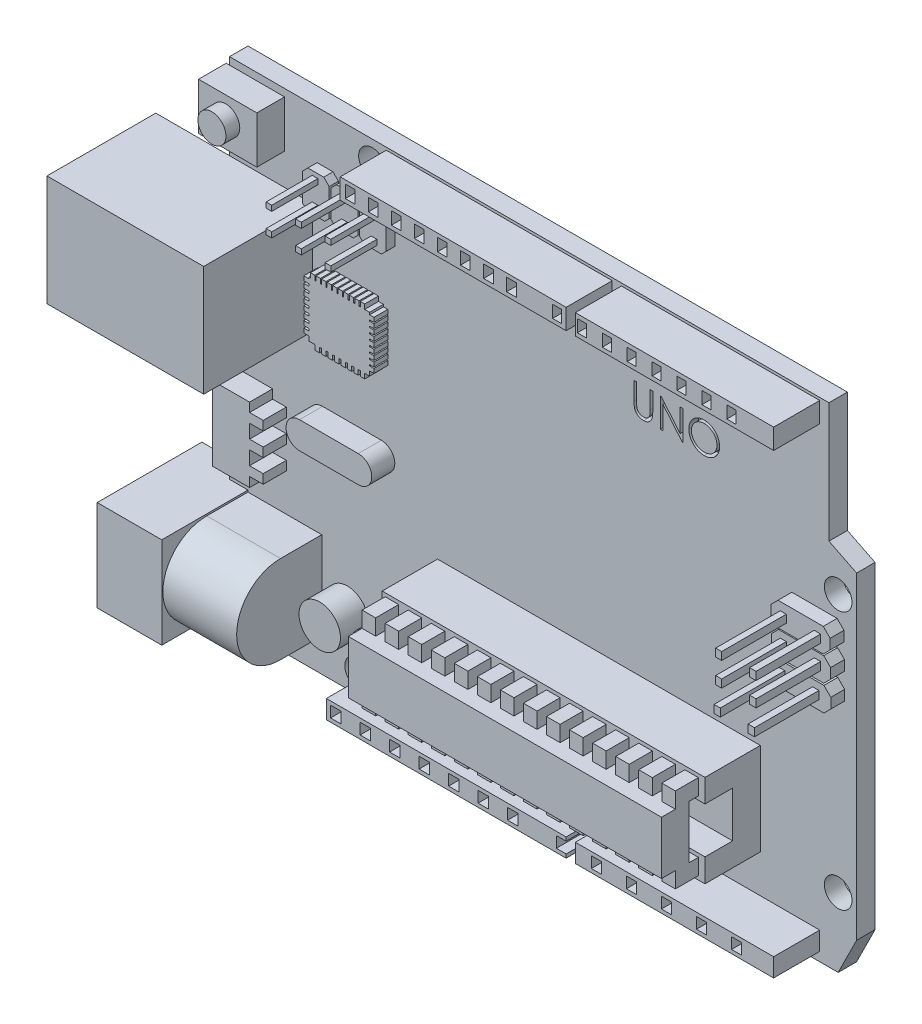
from build123d import *

# Parameters (mm, degrees)
BOSS_EXTRUDE1_DEPTH       = 2
SKETCH2_W                 = 26
SKETCH2_H                 = 2.2
SKETCH2_W_2               = 21.5
BOSS_EXTRUDE2_DEPTH       = 5
SKETCH3_W                 = 1.049746907
SKETCH3_H                 = 1.367804345
CUT_EXTRUDE1_DEPTH        = 5
SKETCH4_W                 = 0.97556606
SKETCH4_H                 = 1.335366902
CUT_EXTRUDE2_DEPTH        = 5
SKETCH5_W                 = 26
SKETCH5_H                 = 2
SKETCH5_W_2               = 21.5
BOSS_EXTRUDE3_DEPTH       = 5
SKETCH6_W                 = 1.138160402
SKETCH6_H                 = 1.2
CUT_EXTRUDE3_DEPTH        = 5
SKETCH7_W                 = 1.077432395
SKETCH7_H                 = 1.2
CUT_EXTRUDE4_DEPTH        = 5
SKETCH8_R                 = 1.5
CUT_EXTRUDE5_DEPTH        = 5
SKETCH9_W                 = 35
SKETCH9_H                 = 10
BOSS_EXTRUDE4_DEPTH       = 6
SKETCH10_W                = 2.996444985
SKETCH10_H                = 4.96379909
CUT_EXTRUDE7_DEPTH        = 35
SKETCH11_W                = 1.469225993
SKETCH11_H                = 1.721786389
CUT_EXTRUDE8_DEPTH        = 5
BOSS_EXTRUDE5_DEPTH       = 2.5
BOSS_EXTRUDE5_DEPTH_BACK  = 4
SKETCH12_W                = 1.469225993
SKETCH12_H                = 1.721786389
BOSS_EXTRUDE6_DEPTH       = 1.5
BOSS_EXTRUDE6_DEPTH_BACK  = 1.5
SKETCH14_W                = 33.969225993
SKETCH14_H                = 5.76399946
BOSS_EXTRUDE7_DEPTH       = 1.5
SKETCH16_W                = 0.697269988
SKETCH16_H                = 0.859966319
SKETCH16_W_2              = 0.674027655
SKETCH16_H_2              = 0.859966318
CUT_EXTRUDE9_DEPTH        = 0.7
BOSS_EXTRUDE8_DEPTH       = 7
BOSS_EXTRUDE8_DEPTH_BACK  = 0.7
SKETCH17_W                = 0.674027655
SKETCH17_H                = 0.859966319
SKETCH17_W_2              = 0.697269988
SKETCH17_W_3              = 0.649555692
SKETCH17_H_2              = 0.84214477
SKETCH17_H_3              = 0.870642791
BOSS_EXTRUDE9_DEPTH       = 1
SKETCH19_W                = 0.612883107
SKETCH19_H                = 0.582238952
BOSS_EXTRUDE10_DEPTH      = 5
BOSS_EXTRUDE11_DEPTH      = 2.5
SKETCH21_W                = 6.591002415
SKETCH21_H                = 5.991820376
BOSS_EXTRUDE12_DEPTH      = 1.5
SKETCH22_W                = 0.548805805
SKETCH22_H                = 0.464846659
SKETCH22_W_2              = 0.467458737
SKETCH22_H_2              = 0.53631011
SKETCH22_W_3              = 0.470164257
SKETCH22_H_3              = 0.517058878
BOSS_EXTRUDE13_DEPTH      = 1.5
SKETCH23_R                = 2.25
BOSS_EXTRUDE14_DEPTH      = 3
BOSS_EXTRUDE16_DEPTH      = 5
BOSS_EXTRUDE16_DEPTH_BACK = 2
SKETCH26_W                = 11.348912623
SKETCH26_H                = 9.9
BOSS_EXTRUDE18_DEPTH      = 8
BOSS_EXTRUDE18_DEPTH_BACK = 9
SKETCH29_W                = 11.8
SKETCH29_H                = 12
CUT_EXTRUDE11_DEPTH       = 11
SKETCH31_W                = 1.392223949
SKETCH31_H                = 4.495210074
BOSS_EXTRUDE19_DEPTH      = 10
SKETCH32_W                = 6.321988741
SKETCH32_H                = 5.098378018
BOSS_EXTRUDE20_DEPTH      = 3
SKETCH33_R                = 1.522317311
BOSS_EXTRUDE21_DEPTH      = 1.5
SKETCH34_W                = 4.013596682
SKETCH34_H                = 8.027193363
BOSS_EXTRUDE22_DEPTH      = 2.5
SKETCH35_W                = 1.481027251
SKETCH35_H                = 1.003309183
BOSS_EXTRUDE23_DEPTH      = 2.5
CUT_EXTRUDE12_DEPTH       = 1
SKETCH39_R                = 0.978088465
BOSS_EXTRUDE25_DEPTH      = 2
BOSS_EXTRUDE25_TAPER      = 26
SKETCH_2_W                = 1.5
SKETCH_2_H                = 2.2
CUT_EXTRUDE_1_DEPTH       = 5
EXTRUDE_2_DEPTH           = 8
SKETCH_6_R                = 3
CUT_EXTRUDE_3_DEPTH       = 5
SKETCH_7_R                = 0.459033844
EXTRUDE_3_DEPTH           = 5


with BuildPart() as part:
    # Sketch1 → Boss-Extrude1 (new body)
    with BuildSketch(Plane.XY):
        Polygon((-28.327231121, 33.812356979), (34.672768879, 33.812356979), (36.672768879, 33.812356979), (36.672768879, 20.812356979), (39.672768879, 19.318339885), (39.672768879, -15.171624714), (37.672768879, -19.187643021), (-28.327231121, -19.187643021), align=None)
    extrude(amount=BOSS_EXTRUDE1_DEPTH)

    # Sketch2 → Boss-Extrude2 (add)
    with BuildSketch(Plane.XY.offset(2)):
        with Locations((0.172768879, 32.424589372)):
            Rectangle(SKETCH2_W, SKETCH2_H)
        with Locations((24.922768879, 32.424589372)):
            Rectangle(SKETCH2_W_2, SKETCH2_H)
    extrude(amount=BOSS_EXTRUDE2_DEPTH)

    # Sketch3 → Cut-Extrude1 (cut)
    with BuildSketch(Plane.XY.offset(7)):
        with Locations((-15.253340387, 32.442227024)):
            Rectangle(SKETCH3_W, SKETCH3_H)
        with Locations((-12.753340387, 32.442227024)):
            Rectangle(SKETCH3_W, SKETCH3_H)
        with Locations((-10.253340387, 32.442227024)):
            Rectangle(SKETCH3_W, SKETCH3_H)
        with Locations((-7.753340388, 32.442227024)):
            Rectangle(SKETCH3_W, SKETCH3_H)
        with Locations((-5.253340387, 32.442227024)):
            Rectangle(SKETCH3_W, SKETCH3_H)
        with Locations((-2.753340388, 32.442227024)):
            Rectangle(SKETCH3_W, SKETCH3_H)
        with Locations((-0.253340387, 32.442227024)):
            Rectangle(SKETCH3_W, SKETCH3_H)
        with Locations((2.246659613, 32.442227024)):
            Rectangle(SKETCH3_W, SKETCH3_H)
        with Locations((4.746659613, 32.442227024)):
            Rectangle(SKETCH3_W, SKETCH3_H)
        with Locations((7.246659613, 32.442227024)):
            Rectangle(SKETCH3_W, SKETCH3_H)
    extrude(amount=-CUT_EXTRUDE1_DEPTH, mode=Mode.SUBTRACT)

    # Sketch4 → Cut-Extrude2 (cut)
    with BuildSketch(Plane.XY.offset(7)):
        with Locations((12.184465787, 32.409753718)):
            Rectangle(SKETCH4_W, SKETCH4_H)
        with Locations((14.884465787, 32.409753718)):
            Rectangle(SKETCH4_W, SKETCH4_H)
        with Locations((17.584465787, 32.409753718)):
            Rectangle(SKETCH4_W, SKETCH4_H)
        with Locations((20.284465787, 32.409753718)):
            Rectangle(SKETCH4_W, SKETCH4_H)
        with Locations((22.984465787, 32.409753718)):
            Rectangle(SKETCH4_W, SKETCH4_H)
        with Locations((25.684465787, 32.409753718)):
            Rectangle(SKETCH4_W, SKETCH4_H)
        with Locations((28.384465787, 32.409753718)):
            Rectangle(SKETCH4_W, SKETCH4_H)
        with Locations((31.084465787, 32.409753718)):
            Rectangle(SKETCH4_W, SKETCH4_H)
    extrude(amount=-CUT_EXTRUDE2_DEPTH, mode=Mode.SUBTRACT)

    # Sketch5 → Boss-Extrude3 (add)
    with BuildSketch(Plane.XY.offset(2)):
        with Locations((0.172768879, -17.212225696)):
            Rectangle(SKETCH5_W, SKETCH5_H)
        with Locations((24.922768879, -17.212225696)):
            Rectangle(SKETCH5_W_2, SKETCH5_H)
    extrude(amount=BOSS_EXTRUDE3_DEPTH)

    # Sketch6 → Cut-Extrude3 (cut)
    with BuildSketch(Plane.XY.offset(7)):
        with Locations((-15.002920658, -17.212225696)):
            Rectangle(SKETCH6_W, SKETCH6_H)
        with Locations((-11.802920658, -17.212225696)):
            Rectangle(SKETCH6_W, SKETCH6_H)
        with Locations((-8.602920658, -17.212225696)):
            Rectangle(SKETCH6_W, SKETCH6_H)
        with Locations((-5.402920658, -17.212225696)):
            Rectangle(SKETCH6_W, SKETCH6_H)
        with Locations((-2.202920658, -17.212225696)):
            Rectangle(SKETCH6_W, SKETCH6_H)
        with Locations((0.997079342, -17.212225696)):
            Rectangle(SKETCH6_W, SKETCH6_H)
        with Locations((4.197079342, -17.212225696)):
            Rectangle(SKETCH6_W, SKETCH6_H)
        with Locations((7.397079342, -17.212225696)):
            Rectangle(SKETCH6_W, SKETCH6_H)
    extrude(amount=-CUT_EXTRUDE3_DEPTH, mode=Mode.SUBTRACT)

    # Sketch7 → Cut-Extrude4 (cut)
    with BuildSketch(Plane.XY.offset(7)):
        with Locations((12.648591204, -17.212225696)):
            Rectangle(SKETCH7_W, SKETCH7_H)
        with Locations((16.448591204, -17.212225696)):
            Rectangle(SKETCH7_W, SKETCH7_H)
        with Locations((20.248591203, -17.212225696)):
            Rectangle(SKETCH7_W, SKETCH7_H)
        with Locations((24.048591204, -17.212225696)):
            Rectangle(SKETCH7_W, SKETCH7_H)
        with Locations((27.848591203, -17.212225696)):
            Rectangle(SKETCH7_W, SKETCH7_H)
        with Locations((31.648591204, -17.212225696)):
            Rectangle(SKETCH7_W, SKETCH7_H)
    extrude(amount=-CUT_EXTRUDE4_DEPTH, mode=Mode.SUBTRACT)

    # Sketch8 → Cut-Extrude5 (cut)
    with BuildSketch(Plane.XY.offset(2)):
        with Locations((37.672768879, 16.312356979)):
            Circle(SKETCH8_R)
        with Locations((37.672768879, -11.687643021)):
            Circle(SKETCH8_R)
        with Locations((-14.327231121, -17.128595339)):
            Circle(SKETCH8_R)
        with Locations((-12.827231121, 31.512356979)):
            Circle(SKETCH8_R)
    extrude(amount=-CUT_EXTRUDE5_DEPTH, mode=Mode.SUBTRACT)

    # Sketch9 → Boss-Extrude4 (add)
    with BuildSketch(Plane.XY.offset(2)):
        with Locations((11.729432951, -7.092296208)):
            Rectangle(SKETCH9_W, SKETCH9_H)
    extrude(amount=BOSS_EXTRUDE4_DEPTH)

    # Sketch10 → Cut-Extrude7 (cut)
    with BuildSketch(Plane(origin=(29.229432951, 0, 0), x_dir=(0, 0, -1), z_dir=(1, 0, 0))):
        with Locations((-6.501777507, -7.074195753)):
            Rectangle(SKETCH10_W, SKETCH10_H)
    extrude(amount=-CUT_EXTRUDE7_DEPTH, mode=Mode.SUBTRACT)

    # Sketch11 → Cut-Extrude8 (cut)
    with BuildSketch(Plane.XY.offset(8)):
        with Locations((-4.718608535, -3.331403014)):
            Rectangle(SKETCH11_W, SKETCH11_H)
        with Locations((-4.718608535, -10.817188863)):
            Rectangle(SKETCH11_W, SKETCH11_H)
        with Locations((-2.218608534, -3.331403014)):
            Rectangle(SKETCH11_W, SKETCH11_H)
        with Locations((-2.218608534, -10.817188863)):
            Rectangle(SKETCH11_W, SKETCH11_H)
        with Locations((0.281391466, -3.331403014)):
            Rectangle(SKETCH11_W, SKETCH11_H)
        with Locations((0.281391466, -10.817188863)):
            Rectangle(SKETCH11_W, SKETCH11_H)
        with Locations((2.781391466, -3.331403014)):
            Rectangle(SKETCH11_W, SKETCH11_H)
        with Locations((2.781391466, -10.817188863)):
            Rectangle(SKETCH11_W, SKETCH11_H)
        with Locations((5.281391466, -3.331403014)):
            Rectangle(SKETCH11_W, SKETCH11_H)
        with Locations((5.281391466, -10.817188863)):
            Rectangle(SKETCH11_W, SKETCH11_H)
        with Locations((7.781391466, -3.331403014)):
            Rectangle(SKETCH11_W, SKETCH11_H)
        with Locations((7.781391466, -10.817188863)):
            Rectangle(SKETCH11_W, SKETCH11_H)
        with Locations((10.281391466, -3.331403014)):
            Rectangle(SKETCH11_W, SKETCH11_H)
        with Locations((10.281391466, -10.817188863)):
            Rectangle(SKETCH11_W, SKETCH11_H)
        with Locations((12.781391466, -3.331403014)):
            Rectangle(SKETCH11_W, SKETCH11_H)
        with Locations((12.781391466, -10.817188863)):
            Rectangle(SKETCH11_W, SKETCH11_H)
        with Locations((15.281391466, -3.331403014)):
            Rectangle(SKETCH11_W, SKETCH11_H)
        with Locations((15.281391466, -10.817188863)):
            Rectangle(SKETCH11_W, SKETCH11_H)
        with Locations((17.781391466, -3.331403014)):
            Rectangle(SKETCH11_W, SKETCH11_H)
        with Locations((17.781391466, -10.817188863)):
            Rectangle(SKETCH11_W, SKETCH11_H)
        with Locations((20.281391466, -3.331403014)):
            Rectangle(SKETCH11_W, SKETCH11_H)
        with Locations((20.281391466, -10.817188863)):
            Rectangle(SKETCH11_W, SKETCH11_H)
        with Locations((22.781391466, -3.331403014)):
            Rectangle(SKETCH11_W, SKETCH11_H)
        with Locations((22.781391466, -10.817188863)):
            Rectangle(SKETCH11_W, SKETCH11_H)
        with Locations((25.281391466, -3.331403014)):
            Rectangle(SKETCH11_W, SKETCH11_H)
        with Locations((25.281391466, -10.817188863)):
            Rectangle(SKETCH11_W, SKETCH11_H)
        with Locations((27.781391466, -3.331403014)):
            Rectangle(SKETCH11_W, SKETCH11_H)
        with Locations((27.781391466, -10.817188863)):
            Rectangle(SKETCH11_W, SKETCH11_H)
    extrude(amount=-CUT_EXTRUDE8_DEPTH, mode=Mode.SUBTRACT)

    # Sketch12 → Boss-Extrude5 (add, two sides: drawn at the far end of the back side and taken through both)
    with BuildSketch(Plane.XY.offset(8).offset(-BOSS_EXTRUDE5_DEPTH_BACK)):
        with Locations((-4.718608535, -3.331403014)):
            Rectangle(SKETCH12_W, SKETCH12_H)
        with Locations((-4.718608535, -10.817188863)):
            Rectangle(SKETCH12_W, SKETCH12_H)
        with Locations((-2.218608534, -3.331403014)):
            Rectangle(SKETCH12_W, SKETCH12_H)
        with Locations((-2.218608534, -10.817188863)):
            Rectangle(SKETCH12_W, SKETCH12_H)
        with Locations((0.281391466, -3.331403014)):
            Rectangle(SKETCH12_W, SKETCH12_H)
        with Locations((0.281391466, -10.817188863)):
            Rectangle(SKETCH12_W, SKETCH12_H)
        with Locations((2.781391466, -3.331403014)):
            Rectangle(SKETCH12_W, SKETCH12_H)
        with Locations((2.781391466, -10.817188863)):
            Rectangle(SKETCH12_W, SKETCH12_H)
        with Locations((5.281391466, -3.331403014)):
            Rectangle(SKETCH12_W, SKETCH12_H)
        with Locations((5.281391466, -10.817188863)):
            Rectangle(SKETCH12_W, SKETCH12_H)
        with Locations((7.781391466, -3.331403014)):
            Rectangle(SKETCH12_W, SKETCH12_H)
        with Locations((7.781391466, -10.817188863)):
            Rectangle(SKETCH12_W, SKETCH12_H)
        with Locations((10.281391466, -3.331403014)):
            Rectangle(SKETCH12_W, SKETCH12_H)
        with Locations((10.281391466, -10.817188863)):
            Rectangle(SKETCH12_W, SKETCH12_H)
        with Locations((12.781391466, -3.331403014)):
            Rectangle(SKETCH12_W, SKETCH12_H)
        with Locations((12.781391466, -10.817188863)):
            Rectangle(SKETCH12_W, SKETCH12_H)
        with Locations((15.281391466, -3.331403014)):
            Rectangle(SKETCH12_W, SKETCH12_H)
        with Locations((15.281391466, -10.817188863)):
            Rectangle(SKETCH12_W, SKETCH12_H)
        with Locations((17.781391466, -3.331403014)):
            Rectangle(SKETCH12_W, SKETCH12_H)
        with Locations((17.781391466, -10.817188863)):
            Rectangle(SKETCH12_W, SKETCH12_H)
        with Locations((20.281391466, -3.331403014)):
            Rectangle(SKETCH12_W, SKETCH12_H)
        with Locations((20.281391466, -10.817188863)):
            Rectangle(SKETCH12_W, SKETCH12_H)
        with Locations((22.781391466, -3.331403014)):
            Rectangle(SKETCH12_W, SKETCH12_H)
        with Locations((22.781391466, -10.817188863)):
            Rectangle(SKETCH12_W, SKETCH12_H)
        with Locations((25.281391466, -3.331403014)):
            Rectangle(SKETCH12_W, SKETCH12_H)
        with Locations((25.281391466, -10.817188863)):
            Rectangle(SKETCH12_W, SKETCH12_H)
        with Locations((27.781391466, -3.331403014)):
            Rectangle(SKETCH12_W, SKETCH12_H)
        with Locations((27.781391466, -10.817188863)):
            Rectangle(SKETCH12_W, SKETCH12_H)
    extrude(amount=BOSS_EXTRUDE5_DEPTH + BOSS_EXTRUDE5_DEPTH_BACK)

    # Sketch14 → Boss-Extrude6 (add, two sides: drawn at the far end of the back side and taken through both)
    with BuildSketch(Plane.XY.offset(10.5).offset(-BOSS_EXTRUDE6_DEPTH_BACK)):
        with Locations((11.531391466, -7.074295938)):
            Rectangle(SKETCH14_W, SKETCH14_H)
    extrude(amount=BOSS_EXTRUDE6_DEPTH + BOSS_EXTRUDE6_DEPTH_BACK)

    # Sketch15 → Boss-Extrude7 (add)
    with BuildSketch(Plane.XY.offset(2)):
        Polygon((32.648796449, 14.001905849), (37.554364321, 14.001905849), (38.30086378, 13.25540639), (38.30086378, 12.153430998), (37.554364321, 11.40693154), (32.648796449, 11.40693154), (31.902296991, 12.153430998), (31.902296991, 13.25540639), align=None)
        Polygon((31.95745647, 9.432230003), (31.95745647, 10.534205394), (32.703955929, 11.280704853), (37.609523801, 11.280704853), (38.356023259, 10.534205394), (38.356023259, 9.432230003), (37.609523801, 8.685730544), (32.703955929, 8.685730544), align=None)
        Polygon((37.627997507, 8.494934517), (38.374496966, 7.748435058), (38.374496966, 6.646459667), (37.627997507, 5.899960208), (32.722429635, 5.899960208), (31.975930177, 6.646459667), (31.975930177, 7.748435058), (32.722429635, 8.494934517), align=None)
    extrude(amount=BOSS_EXTRUDE7_DEPTH)

    # Sketch16 → Cut-Extrude9 (cut)
    with BuildSketch(Plane.XY.offset(3.5)):
        with Locations((36.906767375, 10.134489985)):
            Rectangle(SKETCH16_W, SKETCH16_H)
        with Locations((33.219368171, 12.701903015)):
            Rectangle(SKETCH16_W_2, SKETCH16_H_2)
        with Locations((36.914899108, 12.701903015)):
            Rectangle(SKETCH16_W, SKETCH16_H_2)
        with Locations((33.211236438, 10.134489985)):
            Rectangle(SKETCH16_W_2, SKETCH16_H)
        with Locations((36.746215115, 7.322494267)):
            Rectangle(SKETCH16_W, SKETCH16_H)
        with Locations((33.050684178, 7.322494267)):
            Rectangle(SKETCH16_W_2, SKETCH16_H)
    extrude(amount=-CUT_EXTRUDE9_DEPTH, mode=Mode.SUBTRACT)

    # Sketch17 → Boss-Extrude8 (add, two sides: drawn at the far end of the back side and taken through both)
    with BuildSketch(Plane.XY.offset(3.5).offset(-BOSS_EXTRUDE8_DEPTH_BACK)):
        with Locations((33.050684178, 7.322494267)):
            Rectangle(SKETCH17_W, SKETCH17_H)
        with Locations((36.746215115, 7.322494267)):
            Rectangle(SKETCH17_W_2, SKETCH17_H)
        with Locations((36.91930074, 10.120952765)):
            Rectangle(SKETCH17_W_2, SKETCH17_H)
        with Locations((33.211533821, 10.120952765)):
            Rectangle(SKETCH17_W_3, SKETCH17_H)
        with Locations((33.211533821, 12.706904035)):
            Rectangle(SKETCH17_W_3, SKETCH17_H_2)
        with Locations((36.91930074, 12.700598239)):
            Rectangle(SKETCH17_W_2, SKETCH17_H_3)
    extrude(amount=BOSS_EXTRUDE8_DEPTH + BOSS_EXTRUDE8_DEPTH_BACK)

    # Sketch18 → Boss-Extrude9 (add)
    with BuildSketch(Plane.XY.offset(2)):
        Polygon((-18.835236403, 28.604565204), (-17.111655926, 28.604565204), (-16.517073728, 28.016389961), (-16.517073728, 25.003042012), (-17.00436299, 24.510444738), (-18.893844337, 24.510444738), (-19.417073728, 25.028036039), (-19.417073728, 28.016389961), align=None)
        Polygon((-15.725202743, 28.590242596), (-14.001622266, 28.590242596), (-13.407040068, 28.002067354), (-13.407040068, 24.988719404), (-13.89432933, 24.496122131), (-15.783810676, 24.496122131), (-16.307040068, 25.013713432), (-16.307040068, 28.002067354), align=None)
        Polygon((-12.675606392, 28.604565204), (-10.952025915, 28.604565204), (-10.357443717, 28.016389961), (-10.357443717, 25.003042012), (-10.844732979, 24.510444738), (-12.734214326, 24.510444738), (-13.257443717, 25.028036039), (-13.257443717, 28.016389961), align=None)
    extrude(amount=BOSS_EXTRUDE9_DEPTH)

    # Sketch19 → Boss-Extrude10 (add)
    with BuildSketch(Plane.XY.offset(3)):
        with Locations((-18.055934941, 25.361258481)):
            Rectangle(SKETCH19_W, SKETCH19_H)
        with Locations((-18.055934941, 27.858757142)):
            Rectangle(SKETCH19_W, SKETCH19_H)
        with Locations((-14.85593494, 27.858757142)):
            Rectangle(SKETCH19_W, SKETCH19_H)
        with Locations((-14.85593494, 25.361258481)):
            Rectangle(SKETCH19_W, SKETCH19_H)
        with Locations((-11.65593494, 27.858757142)):
            Rectangle(SKETCH19_W, SKETCH19_H)
        with Locations((-11.65593494, 25.361258481)):
            Rectangle(SKETCH19_W, SKETCH19_H)
    extrude(amount=BOSS_EXTRUDE10_DEPTH)

    # Sketch20 → Boss-Extrude11 (add)
    with BuildSketch(Plane.XY.offset(2)):
        with BuildLine():
            Line((-18.242145427, 6.015306116), (-11.866132062, 6.015306116))
            ThreePointArc((-11.866132062, 6.015306116), (-10.404962333, 4.554136386), (-11.866132062, 3.092966657))
            Line((-11.866132062, 3.092966657), (-18.242145427, 3.092966657))
            ThreePointArc((-18.242145427, 3.092966657), (-19.703315156, 4.554136386), (-18.242145427, 6.015306116))
        make_face()
    extrude(amount=BOSS_EXTRUDE11_DEPTH)

    # Sketch21 → Boss-Extrude12 (add)
    with BuildSketch(Plane.XY.offset(2)):
        with Locations((-14.934167726, 15.901314488)):
            Rectangle(SKETCH21_W, SKETCH21_H)
    extrude(amount=BOSS_EXTRUDE12_DEPTH)

    # Sketch22 → Boss-Extrude13 (add)
    with BuildSketch(Plane.XY.offset(3.5)):
        with Locations((-18.504071835, 18.526676124)):
            Rectangle(SKETCH22_W, SKETCH22_H)
        with Locations((-18.504071835, 17.826676124)):
            Rectangle(SKETCH22_W, SKETCH22_H)
        with Locations((-18.504071835, 17.126676124)):
            Rectangle(SKETCH22_W, SKETCH22_H)
        with Locations((-18.504071835, 16.426676124)):
            Rectangle(SKETCH22_W, SKETCH22_H)
        with Locations((-18.504071835, 15.726676124)):
            Rectangle(SKETCH22_W, SKETCH22_H)
        with Locations((-18.504071835, 15.026676123)):
            Rectangle(SKETCH22_W, SKETCH22_H)
        with Locations((-18.504071835, 14.326676124)):
            Rectangle(SKETCH22_W, SKETCH22_H)
        with Locations((-18.504071835, 13.626676124)):
            Rectangle(SKETCH22_W, SKETCH22_H)
        with Locations((-17.308395783, 12.637249245)):
            Rectangle(SKETCH22_W_2, SKETCH22_H_2)
        with Locations((-16.608395784, 12.637249245)):
            Rectangle(SKETCH22_W_2, SKETCH22_H_2)
        with Locations((-15.908395784, 12.637249245)):
            Rectangle(SKETCH22_W_2, SKETCH22_H_2)
        with Locations((-15.208395784, 12.637249245)):
            Rectangle(SKETCH22_W_2, SKETCH22_H_2)
        with Locations((-14.508395784, 12.637249245)):
            Rectangle(SKETCH22_W_2, SKETCH22_H_2)
        with Locations((-13.808395783, 12.637249245)):
            Rectangle(SKETCH22_W_2, SKETCH22_H_2)
        with Locations((-13.108395784, 12.637249245)):
            Rectangle(SKETCH22_W_2, SKETCH22_H_2)
        with Locations((-11.40358439, 13.626676124)):
            Rectangle(SKETCH22_W_3, SKETCH22_H)
        with Locations((-11.40358439, 14.226676124)):
            Rectangle(SKETCH22_W_3, SKETCH22_H)
        with Locations((-11.40358439, 14.826676124)):
            Rectangle(SKETCH22_W_3, SKETCH22_H)
        with Locations((-11.40358439, 15.426676124)):
            Rectangle(SKETCH22_W_3, SKETCH22_H)
        with Locations((-11.40358439, 16.026676123)):
            Rectangle(SKETCH22_W_3, SKETCH22_H)
        with Locations((-11.40358439, 16.626676124)):
            Rectangle(SKETCH22_W_3, SKETCH22_H)
        with Locations((-11.40358439, 17.826676124)):
            Rectangle(SKETCH22_W_3, SKETCH22_H)
        with Locations((-11.40358439, 18.426676124)):
            Rectangle(SKETCH22_W_3, SKETCH22_H)
        with Locations((-13.008395784, 19.155754115)):
            Rectangle(SKETCH22_W_2, SKETCH22_H_3)
        with Locations((-13.608395784, 19.155754115)):
            Rectangle(SKETCH22_W_2, SKETCH22_H_3)
        with Locations((-14.808395783, 19.155754115)):
            Rectangle(SKETCH22_W_2, SKETCH22_H_3)
        with Locations((-15.408395784, 19.155754115)):
            Rectangle(SKETCH22_W_2, SKETCH22_H_3)
        with Locations((-16.008395783, 19.155754115)):
            Rectangle(SKETCH22_W_2, SKETCH22_H_3)
        with Locations((-16.608395784, 19.155754115)):
            Rectangle(SKETCH22_W_2, SKETCH22_H_3)
        with Locations((-17.208395784, 19.155754115)):
            Rectangle(SKETCH22_W_2, SKETCH22_H_3)
        with Locations((-17.808395783, 19.155754115)):
            Rectangle(SKETCH22_W_2, SKETCH22_H_3)
        with Locations((-12.408395784, 12.637249245)):
            Rectangle(SKETCH22_W_2, SKETCH22_H_2)
        with Locations((-11.40358439, 17.226676123)):
            Rectangle(SKETCH22_W_3, SKETCH22_H)
        with Locations((-12.408395784, 19.155754115)):
            Rectangle(SKETCH22_W_2, SKETCH22_H_3)
        with Locations((-14.208395784, 19.155754115)):
            Rectangle(SKETCH22_W_2, SKETCH22_H_3)
    extrude(amount=-BOSS_EXTRUDE13_DEPTH)

    # Sketch23 → Boss-Extrude14 (add)
    with BuildSketch(Plane.XY.offset(2)):
        with Locations((-15.547522044, -11.757884034)):
            Circle(SKETCH23_R)
        with Locations((-9.964370412, -11.757884034)):
            Circle(SKETCH23_R)
    extrude(amount=BOSS_EXTRUDE14_DEPTH)

    # Sketch26 → Boss-Extrude16 (add, two sides: drawn at the far end of the back side and taken through both)
    with BuildSketch(Plane.ZY.offset(28.327231121).offset(-BOSS_EXTRUDE16_DEPTH_BACK)):
        with Locations((5.674456312, -10.837643021)):
            Rectangle(SKETCH26_W, SKETCH26_H)
    extrude(amount=BOSS_EXTRUDE16_DEPTH + BOSS_EXTRUDE16_DEPTH_BACK)

    # Sketch29 → Boss-Extrude18 (add, two sides: drawn at the far end of the back side and taken through both)
    with BuildSketch(Plane.ZY.offset(28.327231121).offset(-BOSS_EXTRUDE18_DEPTH_BACK)):
        with Locations((7.9, 18.510444738)):
            Rectangle(SKETCH29_W, SKETCH29_H)
    extrude(amount=BOSS_EXTRUDE18_DEPTH + BOSS_EXTRUDE18_DEPTH_BACK)

    # Sketch30 → Cut-Extrude11 (cut)
    with BuildSketch(Plane.ZY.offset(36.327231121)):
        Polygon((4.438160214, 22.883398461), (9.895776615, 22.883398461), (11.679433869, 20.723720353), (11.679433869, 16.297169123), (9.895776615, 14.137491015), (4.438160214, 14.137491015), align=None)
    extrude(amount=-CUT_EXTRUDE11_DEPTH, mode=Mode.SUBTRACT)

    # Sketch31 → Boss-Extrude19 (add)
    with BuildSketch(Plane.ZY.offset(25.327231121)):
        with Locations((7.94452788, 18.510444738)):
            Rectangle(SKETCH31_W, SKETCH31_H)
    extrude(amount=BOSS_EXTRUDE19_DEPTH)

    # Sketch32 → Boss-Extrude20 (add)
    with BuildSketch(Plane.XY.offset(2)):
        with Locations((-25.525277343, 30.465872101)):
            Rectangle(SKETCH32_W, SKETCH32_H)
    extrude(amount=BOSS_EXTRUDE20_DEPTH)

    # Sketch33 → Boss-Extrude21 (add)
    with BuildSketch(Plane.XY.offset(5)):
        with Locations((-25.739155252, 30.658984244)):
            Circle(SKETCH33_R)
    extrude(amount=BOSS_EXTRUDE21_DEPTH)

    # Sketch34 → Boss-Extrude22 (add)
    with BuildSketch(Plane.XY.offset(2)):
        with Locations((-25.6619707, 0.94293189)):
            Rectangle(SKETCH34_W, SKETCH34_H)
    extrude(amount=BOSS_EXTRUDE22_DEPTH)

    # Sketch35 → Boss-Extrude23 (add)
    with BuildSketch(Plane.XY.offset(4.5)):
        with Locations((-22.914658734, 3.478764566)):
            Rectangle(SKETCH35_W, SKETCH35_H)
        with Locations((-22.914658734, 0.978764566)):
            Rectangle(SKETCH35_W, SKETCH35_H)
        with Locations((-22.914658734, -1.521235435)):
            Rectangle(SKETCH35_W, SKETCH35_H)
    extrude(amount=-BOSS_EXTRUDE23_DEPTH)

    # Sketch36 → Cut-Extrude12 (cut)
    # profile 1 of 3: a face of its own
    with BuildSketch(Plane.XY.offset(2)):
        with BuildLine():
            Line((15.53488896, 25.344380581), (15.819824857, 25.344380581))
            Line((15.819824857, 25.344380581), (15.819824857, 23.442051855))
            add(Edge.make_bspline(
                [(15.819824857, 23.442051855), (15.819782454, 23.415127187), (15.819701986, 23.364032991), (15.82023948, 23.29130889), (15.821744765, 23.226654588), (15.822693781, 23.169820865), (15.824805005, 23.121068516), (15.826526805, 23.080133413), (15.828740738, 23.047209386), (15.831401495, 23.02799526), (15.83254521, 23.01973615)],
                knots=[0, 0, 0, 0, 1.528628734, 2.90083645, 4.128790002, 5.200304208, 6.127813768, 6.898992206, 7.526736466, 8, 8, 8, 8], degree=3))
            add(Edge.make_bspline(
                [(15.83254521, 23.01973615), (15.837241904, 22.989939443), (15.846370652, 22.932024967), (15.86963558, 22.849558169), (15.902127171, 22.775234632), (15.940629074, 22.706735103), (15.991367943, 22.645966184), (16.052149721, 22.589984899), (16.125789554, 22.541024762), (16.207668818, 22.496256525), (16.295920426, 22.460274629), (16.386100646, 22.433066363), (16.47685392, 22.41648479), (16.53761087, 22.414564786), (16.567781588, 22.41361135)],
                knots=[0, 0, 0, 0, 1.035780045, 2.013197591, 2.933192213, 3.817615948, 4.702609284, 5.640816605, 6.646850145, 7.73207398, 8.84249596, 9.914020372, 10.964143139, 12, 12, 12, 12], degree=3))
            add(Edge.make_bspline(
                [(16.567781588, 22.41361135), (16.593683909, 22.414585486), (16.645338948, 22.416528131), (16.722089067, 22.428558143), (16.796837737, 22.45023937), (16.869954068, 22.478215437), (16.938489604, 22.515179323), (17.002482583, 22.557879299), (17.059599867, 22.607963451), (17.111722479, 22.663390192), (17.157111314, 22.725928439), (17.196455135, 22.794216464), (17.228682228, 22.869281943), (17.244596712, 22.922036312), (17.252772573, 22.949138193)],
                knots=[0, 0, 0, 0, 0.994687771, 1.983630487, 2.973142513, 3.978332533, 4.983357753, 5.956394766, 6.925816176, 7.893390482, 8.871859704, 9.88551698, 10.913711441, 12, 12, 12, 12], degree=3))
            add(Edge.make_bspline(
                [(17.252772573, 22.949138193), (17.255494116, 22.960340114), (17.261558809, 22.985302508), (17.267225771, 23.027503965), (17.273128119, 23.077296459), (17.277223479, 23.135037747), (17.281216014, 23.200534343), (17.283604588, 23.274127448), (17.28470861, 23.355549834), (17.285037613, 23.412370688), (17.285209472, 23.442051855)],
                knots=[0, 0, 0, 0, 0.558680831, 1.244966039, 2.062412453, 2.990489873, 4.051219941, 5.244515665, 6.560634259, 8, 8, 8, 8], degree=3))
            Line((17.285209472, 23.442051855), (17.285209472, 25.344380581))
            Line((17.285209472, 25.344380581), (17.57014537, 25.344380581))
            Line((17.57014537, 25.344380581), (17.57014537, 23.426787432))
            add(Edge.make_bspline(
                [(17.57014537, 23.426787432), (17.569914846, 23.39222676), (17.569464966, 23.324779506), (17.565563729, 23.225945059), (17.55934345, 23.13218914), (17.55055497, 23.043499147), (17.538909975, 22.960192445), (17.52596031, 22.881538834), (17.509468877, 22.808102905), (17.490207148, 22.739312069), (17.468187573, 22.673829496), (17.43966596, 22.611682396), (17.407530878, 22.550981476), (17.369417585, 22.492644835), (17.326590117, 22.436414176), (17.278101806, 22.382630515), (17.225556318, 22.33043438), (17.168080146, 22.28116467), (17.106620741, 22.235981084), (17.041360922, 22.196250249), (16.972801995, 22.162664539), (16.901122173, 22.135018522), (16.826290868, 22.114231707), (16.748306192, 22.098742101), (16.666990638, 22.089940732), (16.611686985, 22.088632695), (16.583682029, 22.087970324)],
                knots=[0, 0, 0, 0, 1.316592851, 2.569410997, 3.76748051, 4.895814652, 5.963796859, 6.97159953, 7.931736103, 8.829262218, 9.692595152, 10.560224239, 11.431080259, 12.30701507, 13.211635791, 14.121146779, 15.063487852, 16.031507147, 17.00238618, 17.966455255, 18.938106653, 19.907068911, 20.888905087, 21.893141452, 22.933117798, 24, 24, 24, 24], degree=3))
            add(Edge.make_bspline(
                [(16.583682029, 22.087970324), (16.553139343, 22.088682219), (16.493214702, 22.090078953), (16.40491517, 22.098082447), (16.320265863, 22.113157705), (16.238372746, 22.132352797), (16.160350752, 22.158826616), (16.085154556, 22.189758486), (16.014072038, 22.227747144), (15.945950029, 22.270014007), (15.882609, 22.317570643), (15.824463499, 22.369404944), (15.77141753, 22.424686572), (15.724365213, 22.484014047), (15.682526982, 22.546925952), (15.646486003, 22.613600263), (15.615540417, 22.684011164), (15.599568745, 22.732954424), (15.591494529, 22.757696887)],
                knots=[0, 0, 0, 0, 1.13879206, 2.234305948, 3.301075583, 4.341971843, 5.366689343, 6.369221514, 7.369726634, 8.367512178, 9.355451585, 10.318319045, 11.268648973, 12.207971039, 13.137398894, 14.081662264, 15.030215811, 16, 16, 16, 16], degree=3))
            add(Edge.make_bspline(
                [(15.591494529, 22.757696887), (15.586798106, 22.774599294), (15.576611462, 22.811260991), (15.5657028, 22.871936591), (15.556532418, 22.941800123), (15.547909519, 23.02085637), (15.542821393, 23.109166606), (15.538360574, 23.206692551), (15.534857534, 23.313552131), (15.534878192, 23.387987299), (15.53488896, 23.426787432)],
                knots=[0, 0, 0, 0, 0.625038921, 1.35572334, 2.194682327, 3.136881307, 4.189498639, 5.346923369, 6.617055217, 8, 8, 8, 8], degree=3))
            Line((15.53488896, 23.426787432), (15.53488896, 25.344380581))
        make_face()
    # profile 2 of 3: a face of its own
    with BuildSketch(Plane.XY.offset(2)):
        Polygon((18.384247934, 22.169380581), (18.384247934, 25.344380581), (18.444033591, 25.344380581), (20.541619729, 22.84546732), (20.541619729, 25.344380581), (20.826555626, 25.344380581), (20.826555626, 22.169380581), (20.761681828, 22.169380581), (18.669183831, 24.662569683), (18.669183831, 22.169380581), align=None)
    # profile 3 of 3: a face of its own
    with BuildSketch(Plane.XY.offset(2)):
        with BuildLine():
            add(Edge.make_bspline(
                [(23.12639537, 25.425790837), (23.18518558, 25.424301781), (23.300654404, 25.421377152), (23.470358061, 25.398989679), (23.632369326, 25.360258861), (23.788007952, 25.308676013), (23.935412295, 25.239865249), (24.075691862, 25.156693721), (24.208512883, 25.058290077), (24.332085136, 24.945414992), (24.445166798, 24.822602859), (24.544794567, 24.691540755), (24.628290076, 24.553021127), (24.696857183, 24.407460231), (24.750649493, 24.25518726), (24.787768911, 24.095390414), (24.811479947, 23.92910506), (24.814251974, 23.815687833), (24.81565819, 23.758152616)],
                knots=[0, 0, 0, 0, 1.065120563, 2.091984664, 3.0946048, 4.079830382, 5.057816894, 6.036188127, 7.030412546, 8.04752943, 9.064399622, 10.05169764, 11.02544977, 11.989514704, 12.962713494, 13.945757189, 14.957906945, 16, 16, 16, 16], degree=3))
            add(Edge.make_bspline(
                [(24.81565819, 23.758152616), (24.81425218, 23.701041218), (24.811480771, 23.588468037), (24.787741952, 23.423237913), (24.750511902, 23.264405638), (24.697356717, 23.112236367), (24.629116462, 22.966569577), (24.545064985, 22.827788555), (24.446058315, 22.695847803), (24.333384958, 22.572192742), (24.21055687, 22.458802179), (24.07881227, 22.359997199), (23.941114044, 22.274976029), (23.795690238, 22.207136553), (23.64446949, 22.152914883), (23.486098383, 22.115946426), (23.321319009, 22.092100322), (23.208950312, 22.089362097), (23.151836075, 22.087970324)],
                knots=[0, 0, 0, 0, 1.043624062, 2.057103931, 3.04512605, 4.022047818, 4.998200453, 5.980619268, 6.982898556, 8.009068085, 9.034988726, 10.034168286, 11.015286542, 11.987931943, 12.962482838, 13.94673481, 14.956375938, 16, 16, 16, 16], degree=3))
            add(Edge.make_bspline(
                [(23.151836075, 22.087970324), (23.094301157, 22.08937584), (22.980884518, 22.092146484), (22.814390208, 22.115896759), (22.654481111, 22.15303637), (22.501614521, 22.206112787), (22.355705192, 22.274708418), (22.21646776, 22.358350962), (22.084461105, 22.457598868), (21.960779664, 22.57023569), (21.84761432, 22.692855597), (21.748954029, 22.824240957), (21.665292676, 22.961814122), (21.596927367, 23.105956876), (21.542803179, 23.255972399), (21.505878094, 23.412861375), (21.481987623, 23.575729355), (21.479234584, 23.686621127), (21.477837678, 23.742888193)],
                knots=[0, 0, 0, 0, 1.053102029, 2.075944431, 3.073151272, 4.055350789, 5.033113405, 6.020478099, 7.024410459, 8.052272461, 9.079885166, 10.07527673, 11.055994387, 12.023226415, 12.992069828, 13.970394897, 14.97016774, 16, 16, 16, 16], degree=3))
            add(Edge.make_bspline(
                [(21.477837678, 23.742888193), (21.478322668, 23.780654971), (21.479286532, 23.855712084), (21.490890424, 23.967169642), (21.507728539, 24.076834739), (21.531860274, 24.184395527), (21.563421286, 24.289588706), (21.600661339, 24.393139756), (21.646145342, 24.493999276), (21.697562787, 24.592645067), (21.754950284, 24.687539382), (21.818337571, 24.77723729), (21.885498227, 24.86249148), (21.95912502, 24.94109269), (22.036791366, 25.015327507), (22.119757181, 25.084055115), (22.207516217, 25.147895249), (22.30044609, 25.205426558), (22.396256953, 25.257459487), (22.495023745, 25.302110738), (22.595405063, 25.340433951), (22.697871065, 25.371495271), (22.802149651, 25.396017189), (22.908468413, 25.412715289), (23.01674265, 25.424348777), (23.089687203, 25.425308082), (23.12639537, 25.425790837)],
                knots=[0, 0, 0, 0, 1.037015668, 2.060948919, 3.074880161, 4.083647147, 5.086022904, 6.090072063, 7.104153813, 8.122640571, 9.144368836, 10.147691507, 11.138137339, 12.123020368, 13.103399296, 14.087645067, 15.080126199, 16.082011238, 17.087798457, 18.072939717, 19.057185487, 20.037253025, 21.01195951, 21.997135196, 22.992090687, 24, 24, 24, 24], degree=3))
        make_face()
        with BuildLine():
            add(Edge.make_bspline(
                [(23.140387758, 25.100149812), (23.11025734, 25.099782518), (23.050284554, 25.099051443), (22.961126439, 25.089421473), (22.873140899, 25.075696502), (22.786309763, 25.056118979), (22.700996344, 25.029445303), (22.616405416, 24.998746765), (22.53330836, 24.961353347), (22.451979503, 24.919105251), (22.373135114, 24.872343016), (22.298737877, 24.820661484), (22.228595193, 24.765272653), (22.162878801, 24.706047257), (22.101781667, 24.64268369), (22.044101259, 24.576142552), (21.992149567, 24.504521907), (21.944537651, 24.429763896), (21.90193111, 24.35196589), (21.864043967, 24.271946943), (21.83305233, 24.189054327), (21.807777175, 24.104187342), (21.786822346, 24.017480396), (21.773547286, 23.928275733), (21.763811503, 23.837021596), (21.763122215, 23.775352343), (21.762773575, 23.744160228)],
                knots=[0, 0, 0, 0, 1.008559885, 2.007477868, 2.99961109, 3.989939068, 4.984837346, 5.991145699, 7.001802488, 8.033829008, 9.059044045, 10.069351652, 11.065060232, 12.050310815, 13.029377138, 14.011219647, 14.996725999, 15.989392538, 16.977580475, 17.965360261, 18.951710183, 19.937753436, 20.929683414, 21.935841486, 22.955955122, 24, 24, 24, 24], degree=3))
            add(Edge.make_bspline(
                [(21.762773575, 23.744160228), (21.763930057, 23.698293071), (21.766205215, 23.608058183), (21.786123868, 23.475825652), (21.81680523, 23.348745564), (21.862032984, 23.22751326), (21.918593899, 23.111086661), (21.988468292, 23.000498595), (22.07125332, 22.895719173), (22.165290947, 22.797479893), (22.268090831, 22.707812628), (22.377249808, 22.629105821), (22.491598437, 22.562512238), (22.611434914, 22.508260493), (22.736119467, 22.465271231), (22.866455531, 22.435808473), (23.001574877, 22.416417881), (23.093677685, 22.414555739), (23.140387758, 22.41361135)],
                knots=[0, 0, 0, 0, 1.032063989, 2.030389145, 3.003944642, 3.970395727, 4.937377036, 5.913328081, 6.909231446, 7.93887556, 8.970685674, 9.976071282, 10.964166581, 11.944589148, 12.933237628, 13.927779006, 14.949070134, 16, 16, 16, 16], degree=3))
            add(Edge.make_bspline(
                [(23.140387758, 22.41361135), (23.17178352, 22.414042701), (23.234050746, 22.414898198), (23.32666597, 22.423514855), (23.417612676, 22.437332336), (23.506763301, 22.457226574), (23.594016666, 22.482125111), (23.679736952, 22.511704979), (23.763011115, 22.548608642), (23.844889682, 22.589382855), (23.923263416, 22.635864998), (23.998080506, 22.685792462), (24.067455144, 22.741099711), (24.133122374, 22.799445155), (24.194470349, 22.862005217), (24.251084213, 22.928698562), (24.302773333, 22.999946158), (24.350367169, 23.074590776), (24.392824415, 23.152601662), (24.429816883, 23.232910727), (24.461200503, 23.315320219), (24.486535646, 23.399949002), (24.506388886, 23.486636343), (24.520068528, 23.575498314), (24.529637469, 23.666357146), (24.530358717, 23.727810501), (24.530722293, 23.758788634)],
                knots=[0, 0, 0, 0, 1.047197238, 2.076906641, 3.100256066, 4.114471768, 5.12198147, 6.126382909, 7.136867548, 8.15857795, 9.17633901, 10.174870724, 11.156907918, 12.133735059, 13.104061851, 14.077631395, 15.04955518, 16.038496417, 17.029181396, 18.010275684, 18.986308667, 19.968651475, 20.955262928, 21.950658345, 22.966943676, 24, 24, 24, 24], degree=3))
            add(Edge.make_bspline(
                [(24.530722293, 23.758788634), (24.530358426, 23.789554841), (24.529636629, 23.850585281), (24.520073099, 23.940810452), (24.506374434, 24.029033008), (24.486632549, 24.114906601), (24.461187052, 24.19845312), (24.429811403, 24.279594098), (24.392813309, 24.358631818), (24.350351563, 24.43537093), (24.302621495, 24.509008014), (24.250466002, 24.579404488), (24.19298458, 24.645238332), (24.131819543, 24.708134805), (24.065443097, 24.766752462), (23.994155916, 24.821110748), (23.918823437, 24.872521504), (23.839060873, 24.918899692), (23.756743144, 24.961729746), (23.672275482, 24.998424585), (23.586614798, 25.029605008), (23.499978925, 25.056199683), (23.411638652, 25.075619825), (23.322190893, 25.089433841), (23.231759401, 25.099048091), (23.170941623, 25.099781406), (23.140387758, 25.100149812)],
                knots=[0, 0, 0, 0, 1.02996197, 2.043119294, 3.035359645, 4.018872909, 4.991431989, 5.957985074, 6.929999688, 7.912076566, 8.892894881, 9.867085534, 10.843653904, 11.817741046, 12.803660682, 13.806313499, 14.818574707, 15.856120519, 16.894564902, 17.924820532, 18.937903209, 19.946497019, 20.957711757, 21.963978472, 22.977135795, 24, 24, 24, 24], degree=3))
        make_face(mode=Mode.SUBTRACT)
    extrude(amount=-CUT_EXTRUDE12_DEPTH, mode=Mode.SUBTRACT)

    # Sketch39 → Boss-Extrude25 (add)
    with BuildSketch(Plane(origin=(0, 0, 0), x_dir=(-1, 0, 0), z_dir=(0, 0, -1))):
        with Locations((-32.380812079, 0)):
            Circle(SKETCH39_R)
        with Locations((-29.380812079, 0)):
            Circle(SKETCH39_R)
        with Locations((-26.380812079, 0)):
            Circle(SKETCH39_R)
        with Locations((-23.380812079, 0)):
            Circle(SKETCH39_R)
        with Locations((-20.380812079, 0)):
            Circle(SKETCH39_R)
        with Locations((-17.380812079, 0)):
            Circle(SKETCH39_R)
        with Locations((-14.380812079, 0)):
            Circle(SKETCH39_R)
        with Locations((-11.380812079, 0)):
            Circle(SKETCH39_R)
        with Locations((-8.380812079, 0)):
            Circle(SKETCH39_R)
        with Locations((-5.380812079, 0)):
            Circle(SKETCH39_R)
        with Locations((-2.380812079, 0)):
            Circle(SKETCH39_R)
        with Locations((0.619187921, 0)):
            Circle(SKETCH39_R)
        with Locations((3.619187921, 0)):
            Circle(SKETCH39_R)
        with Locations((6.619187921, 0)):
            Circle(SKETCH39_R)
        with Locations((-29.380812079, -5)):
            Circle(SKETCH39_R)
        with Locations((-26.380812079, -5)):
            Circle(SKETCH39_R)
        with Locations((-23.380812079, -5)):
            Circle(SKETCH39_R)
        with Locations((-20.380812079, -5)):
            Circle(SKETCH39_R)
        with Locations((-17.380812079, -5)):
            Circle(SKETCH39_R)
        with Locations((-14.380812079, -5)):
            Circle(SKETCH39_R)
        with Locations((-11.380812079, -5)):
            Circle(SKETCH39_R)
        with Locations((-8.380812079, -5)):
            Circle(SKETCH39_R)
        with Locations((-5.380812079, -5)):
            Circle(SKETCH39_R)
        with Locations((-2.380812079, -5)):
            Circle(SKETCH39_R)
        with Locations((0.619187921, -5)):
            Circle(SKETCH39_R)
        with Locations((3.619187921, -5)):
            Circle(SKETCH39_R)
        with Locations((6.619187921, -5)):
            Circle(SKETCH39_R)
        with Locations((-32.380812079, -5)):
            Circle(SKETCH39_R)
    extrude(amount=BOSS_EXTRUDE25_DEPTH, taper=BOSS_EXTRUDE25_TAPER)

    # Boss-Extrude26 cone 1 section (through the dimple's axis) → Boss-Extrude26 (revolve)
    with BuildSketch(Plane(origin=(32.457996631, 31.812356979, 0), x_dir=(0, -1, 0), z_dir=(1, 0, 0))):
        Polygon((0, 0), (0.982398957, 0), (0, 1.456466349), align=None)
    revolve(axis=Axis((32.457996631, 31.812356979, 0), (0, 0, -1)))

    # Boss-Extrude26 cone 2 section (through the dimple's axis) → Boss-Extrude26 cone 2 (revolve)
    with BuildSketch(Plane(origin=(29.457996631, 31.812356979, 0), x_dir=(0, -1, 0), z_dir=(1, 0, 0))):
        Polygon((0, 0), (0.982398957, 0), (0, 1.456466349), align=None)
    revolve(axis=Axis((29.457996631, 31.812356979, 0), (0, 0, -1)))

    # Boss-Extrude26 cone 3 section (through the dimple's axis) → Boss-Extrude26 cone 3 (revolve)
    with BuildSketch(Plane(origin=(26.457996631, 31.812356979, 0), x_dir=(0, -1, 0), z_dir=(1, 0, 0))):
        Polygon((0, 0), (0.982398957, 0), (0, 1.456466349), align=None)
    revolve(axis=Axis((26.457996631, 31.812356979, 0), (0, 0, -1)))

    # Boss-Extrude26 cone 4 section (through the dimple's axis) → Boss-Extrude26 cone 4 (revolve)
    with BuildSketch(Plane(origin=(23.457996631, 31.812356979, 0), x_dir=(0, -1, 0), z_dir=(1, 0, 0))):
        Polygon((0, 0), (0.982398957, 0), (0, 1.456466349), align=None)
    revolve(axis=Axis((23.457996631, 31.812356979, 0), (0, 0, -1)))

    # Boss-Extrude26 cone 5 section (through the dimple's axis) → Boss-Extrude26 cone 5 (revolve)
    with BuildSketch(Plane(origin=(20.457996631, 31.812356979, 0), x_dir=(0, -1, 0), z_dir=(1, 0, 0))):
        Polygon((0, 0), (0.982398957, 0), (0, 1.456466349), align=None)
    revolve(axis=Axis((20.457996631, 31.812356979, 0), (0, 0, -1)))

    # Boss-Extrude26 cone 6 section (through the dimple's axis) → Boss-Extrude26 cone 6 (revolve)
    with BuildSketch(Plane(origin=(17.457996631, 31.812356979, 0), x_dir=(0, -1, 0), z_dir=(1, 0, 0))):
        Polygon((0, 0), (0.982398957, 0), (0, 1.456466349), align=None)
    revolve(axis=Axis((17.457996631, 31.812356979, 0), (0, 0, -1)))

    # Boss-Extrude26 cone 7 section (through the dimple's axis) → Boss-Extrude26 cone 7 (revolve)
    with BuildSketch(Plane(origin=(14.457996631, 31.812356979, 0), x_dir=(0, -1, 0), z_dir=(1, 0, 0))):
        Polygon((0, 0), (0.982398957, 0), (0, 1.456466349), align=None)
    revolve(axis=Axis((14.457996631, 31.812356979, 0), (0, 0, -1)))

    # Boss-Extrude26 cone 8 section (through the dimple's axis) → Boss-Extrude26 cone 8 (revolve)
    with BuildSketch(Plane(origin=(11.457996631, 31.812356979, 0), x_dir=(0, -1, 0), z_dir=(1, 0, 0))):
        Polygon((0, 0), (0.982398957, 0), (0, 1.456466349), align=None)
    revolve(axis=Axis((11.457996631, 31.812356979, 0), (0, 0, -1)))

    # Boss-Extrude26 cone 9 section (through the dimple's axis) → Boss-Extrude26 cone 9 (revolve)
    with BuildSketch(Plane(origin=(8.457996631, 31.812356979, 0), x_dir=(0, -1, 0), z_dir=(1, 0, 0))):
        Polygon((0, 0), (0.982398957, 0), (0, 1.456466349), align=None)
    revolve(axis=Axis((8.457996631, 31.812356979, 0), (0, 0, -1)))

    # Boss-Extrude26 cone 10 section (through the dimple's axis) → Boss-Extrude26 cone 10 (revolve)
    with BuildSketch(Plane(origin=(5.457996631, 31.812356979, 0), x_dir=(0, -1, 0), z_dir=(1, 0, 0))):
        Polygon((0, 0), (0.982398957, 0), (0, 1.456466349), align=None)
    revolve(axis=Axis((5.457996631, 31.812356979, 0), (0, 0, -1)))

    # Boss-Extrude26 cone 11 section (through the dimple's axis) → Boss-Extrude26 cone 11 (revolve)
    with BuildSketch(Plane(origin=(2.457996631, 31.812356979, 0), x_dir=(0, -1, 0), z_dir=(1, 0, 0))):
        Polygon((0, 0), (0.982398957, 0), (0, 1.456466349), align=None)
    revolve(axis=Axis((2.457996631, 31.812356979, 0), (0, 0, -1)))

    # Boss-Extrude26 cone 12 section (through the dimple's axis) → Boss-Extrude26 cone 12 (revolve)
    with BuildSketch(Plane(origin=(-0.542003369, 31.812356979, 0), x_dir=(0, -1, 0), z_dir=(1, 0, 0))):
        Polygon((0, 0), (0.982398957, 0), (0, 1.456466349), align=None)
    revolve(axis=Axis((-0.542003369, 31.812356979, 0), (0, 0, -1)))

    # Boss-Extrude26 cone 13 section (through the dimple's axis) → Boss-Extrude26 cone 13 (revolve)
    with BuildSketch(Plane(origin=(-3.542003369, 31.812356979, 0), x_dir=(0, -1, 0), z_dir=(1, 0, 0))):
        Polygon((0, 0), (0.982398957, 0), (0, 1.456466349), align=None)
    revolve(axis=Axis((-3.542003369, 31.812356979, 0), (0, 0, -1)))

    # Boss-Extrude26 cone 14 section (through the dimple's axis) → Boss-Extrude26 cone 14 (revolve)
    with BuildSketch(Plane(origin=(-6.542003369, 31.812356979, 0), x_dir=(0, -1, 0), z_dir=(1, 0, 0))):
        Polygon((0, 0), (0.982398957, 0), (0, 1.456466349), align=None)
    revolve(axis=Axis((-6.542003369, 31.812356979, 0), (0, 0, -1)))

    # Boss-Extrude26 cone 15 section (through the dimple's axis) → Boss-Extrude26 cone 15 (revolve)
    with BuildSketch(Plane(origin=(-9.542003369, 31.812356979, 0), x_dir=(0, -1, 0), z_dir=(1, 0, 0))):
        Polygon((0, 0), (0.982398957, 0), (0, 1.456466349), align=None)
    revolve(axis=Axis((-9.542003369, 31.812356979, 0), (0, 0, -1)))

    # Boss-Extrude27 cone 1 section (through the dimple's axis) → Boss-Extrude27 (revolve)
    with BuildSketch(Plane(origin=(-26.896923525, 26.02791115, 0), x_dir=(0, -1, 0), z_dir=(1, 0, 0))):
        Polygon((0, 0), (0.967119659, 0), (0, 1.433813859), align=None)
    revolve(axis=Axis((-26.896923525, 26.02791115, 0), (0, 0, -1)))

    # Boss-Extrude27 cone 2 section (through the dimple's axis) → Boss-Extrude27 cone 2 (revolve)
    with BuildSketch(Plane(origin=(-26.896923525, 15.762365791, 0), x_dir=(0, -1, 0), z_dir=(1, 0, 0))):
        Polygon((0, 0), (1.006363428, 0), (0, 1.491995139), align=None)
    revolve(axis=Axis((-26.896923525, 15.762365791, 0), (0, 0, -1)))

    # Boss-Extrude27 cone 3 section (through the dimple's axis) → Boss-Extrude27 cone 3 (revolve)
    with BuildSketch(Plane(origin=(-20.490605745, -8.859506159, 0), x_dir=(0, -1, 0), z_dir=(1, 0, 0))):
        Polygon((0, 0), (0.988444546, 0), (0, 1.465429303), align=None)
    revolve(axis=Axis((-20.490605745, -8.859506159, 0), (0, 0, -1)))

    # Boss-Extrude27 cone 4 section (through the dimple's axis) → Boss-Extrude27 cone 4 (revolve)
    with BuildSketch(Plane(origin=(-25.890560097, -8.859506159, 0), x_dir=(0, -1, 0), z_dir=(1, 0, 0))):
        Polygon((0, 0), (1.00339917, 0), (0, 1.487600446), align=None)
    revolve(axis=Axis((-25.890560097, -8.859506159, 0), (0, 0, -1)))

    # Boss-Extrude27 cone 5 section (through the dimple's axis) → Boss-Extrude27 cone 5 (revolve)
    with BuildSketch(Plane(origin=(-23.19206505, -12.33281098, 0), x_dir=(0, -1, 0), z_dir=(1, 0, 0))):
        Polygon((0, 0), (1.038411939, 0), (0, 1.53950901), align=None)
    revolve(axis=Axis((-23.19206505, -12.33281098, 0), (0, 0, -1)))

    # Boss-Extrude27 cone 6 section (through the dimple's axis) → Boss-Extrude27 cone 6 (revolve)
    with BuildSketch(Plane(origin=(36.378284798, 13.102859541, 0), x_dir=(0, -1, 0), z_dir=(1, 0, 0))):
        Polygon((0, 0), (0.98314812, 0), (0, 1.457577028), align=None)
    revolve(axis=Axis((36.378284798, 13.102859541, 0), (0, 0, -1)))

    # Boss-Extrude27 cone 7 section (through the dimple's axis) → Boss-Extrude27 cone 7 (revolve)
    with BuildSketch(Plane(origin=(32.766923556, 13.102859541, 0), x_dir=(0, -1, 0), z_dir=(1, 0, 0))):
        Polygon((0, 0), (1.017299928, 0), (0, 1.508209166), align=None)
    revolve(axis=Axis((32.766923556, 13.102859541, 0), (0, 0, -1)))

    # Boss-Extrude27 cone 8 section (through the dimple's axis) → Boss-Extrude27 cone 8 (revolve)
    with BuildSketch(Plane(origin=(32.766923556, 10.113526782, 0), x_dir=(0, -1, 0), z_dir=(1, 0, 0))):
        Polygon((0, 0), (0.972873009, 0), (0, 1.442343551), align=None)
    revolve(axis=Axis((32.766923556, 10.113526782, 0), (0, 0, -1)))

    # Boss-Extrude27 cone 9 section (through the dimple's axis) → Boss-Extrude27 cone 9 (revolve)
    with BuildSketch(Plane(origin=(36.378284798, 10.113526782, 0), x_dir=(0, -1, 0), z_dir=(1, 0, 0))):
        Polygon((0, 0), (1.024856248, 0), (0, 1.519411871), align=None)
    revolve(axis=Axis((36.378284798, 10.113526782, 0), (0, 0, -1)))

    # Boss-Extrude27 cone 10 section (through the dimple's axis) → Boss-Extrude27 cone 10 (revolve)
    with BuildSketch(Plane(origin=(36.378284798, 6.989462135, 0), x_dir=(0, -1, 0), z_dir=(1, 0, 0))):
        Polygon((0, 0), (1.021319869, 0), (0, 1.514168975), align=None)
    revolve(axis=Axis((36.378284798, 6.989462135, 0), (0, 0, -1)))

    # Boss-Extrude27 cone 11 section (through the dimple's axis) → Boss-Extrude27 cone 11 (revolve)
    with BuildSketch(Plane(origin=(32.766923556, 6.989462135, 0), x_dir=(0, -1, 0), z_dir=(1, 0, 0))):
        Polygon((0, 0), (1.040185859, 0), (0, 1.542138954), align=None)
    revolve(axis=Axis((32.766923556, 6.989462135, 0), (0, 0, -1)))

    # Boss-Extrude28 cone 1 section (through the dimple's axis) → Boss-Extrude28 (revolve)
    with BuildSketch(Plane(origin=(31.994889321, -17.27262228, 0), x_dir=(0, -1, 0), z_dir=(1, 0, 0))):
        Polygon((0, 0), (1.035539425, 0), (0, 1.535250332), align=None)
    revolve(axis=Axis((31.994889321, -17.27262228, 0), (0, 0, -1)))

    # Boss-Extrude28 cone 2 section (through the dimple's axis) → Boss-Extrude28 cone 2 (revolve)
    with BuildSketch(Plane(origin=(28.994889321, -17.27262228, 0), x_dir=(0, -1, 0), z_dir=(1, 0, 0))):
        Polygon((0, 0), (1.035539425, 0), (0, 1.535250332), align=None)
    revolve(axis=Axis((28.994889321, -17.27262228, 0), (0, 0, -1)))

    # Boss-Extrude28 cone 3 section (through the dimple's axis) → Boss-Extrude28 cone 3 (revolve)
    with BuildSketch(Plane(origin=(25.994889321, -17.27262228, 0), x_dir=(0, -1, 0), z_dir=(1, 0, 0))):
        Polygon((0, 0), (1.035539425, 0), (0, 1.535250332), align=None)
    revolve(axis=Axis((25.994889321, -17.27262228, 0), (0, 0, -1)))

    # Boss-Extrude28 cone 4 section (through the dimple's axis) → Boss-Extrude28 cone 4 (revolve)
    with BuildSketch(Plane(origin=(22.994889321, -17.27262228, 0), x_dir=(0, -1, 0), z_dir=(1, 0, 0))):
        Polygon((0, 0), (1.035539425, 0), (0, 1.535250332), align=None)
    revolve(axis=Axis((22.994889321, -17.27262228, 0), (0, 0, -1)))

    # Boss-Extrude28 cone 5 section (through the dimple's axis) → Boss-Extrude28 cone 5 (revolve)
    with BuildSketch(Plane(origin=(19.994889321, -17.27262228, 0), x_dir=(0, -1, 0), z_dir=(1, 0, 0))):
        Polygon((0, 0), (1.035539425, 0), (0, 1.535250332), align=None)
    revolve(axis=Axis((19.994889321, -17.27262228, 0), (0, 0, -1)))

    # Boss-Extrude28 cone 6 section (through the dimple's axis) → Boss-Extrude28 cone 6 (revolve)
    with BuildSketch(Plane(origin=(16.994889321, -17.27262228, 0), x_dir=(0, -1, 0), z_dir=(1, 0, 0))):
        Polygon((0, 0), (1.035539425, 0), (0, 1.535250332), align=None)
    revolve(axis=Axis((16.994889321, -17.27262228, 0), (0, 0, -1)))

    # Boss-Extrude28 cone 7 section (through the dimple's axis) → Boss-Extrude28 cone 7 (revolve)
    with BuildSketch(Plane(origin=(13.994889321, -17.27262228, 0), x_dir=(0, -1, 0), z_dir=(1, 0, 0))):
        Polygon((0, 0), (1.035539425, 0), (0, 1.535250332), align=None)
    revolve(axis=Axis((13.994889321, -17.27262228, 0), (0, 0, -1)))

    # Boss-Extrude28 cone 8 section (through the dimple's axis) → Boss-Extrude28 cone 8 (revolve)
    with BuildSketch(Plane(origin=(10.994889321, -17.27262228, 0), x_dir=(0, -1, 0), z_dir=(1, 0, 0))):
        Polygon((0, 0), (1.035539425, 0), (0, 1.535250332), align=None)
    revolve(axis=Axis((10.994889321, -17.27262228, 0), (0, 0, -1)))

    # Boss-Extrude28 cone 9 section (through the dimple's axis) → Boss-Extrude28 cone 9 (revolve)
    with BuildSketch(Plane(origin=(7.994889321, -17.27262228, 0), x_dir=(0, -1, 0), z_dir=(1, 0, 0))):
        Polygon((0, 0), (1.035539425, 0), (0, 1.535250332), align=None)
    revolve(axis=Axis((7.994889321, -17.27262228, 0), (0, 0, -1)))

    # Boss-Extrude28 cone 10 section (through the dimple's axis) → Boss-Extrude28 cone 10 (revolve)
    with BuildSketch(Plane(origin=(4.994889321, -17.27262228, 0), x_dir=(0, -1, 0), z_dir=(1, 0, 0))):
        Polygon((0, 0), (1.035539425, 0), (0, 1.535250332), align=None)
    revolve(axis=Axis((4.994889321, -17.27262228, 0), (0, 0, -1)))

    # Boss-Extrude28 cone 11 section (through the dimple's axis) → Boss-Extrude28 cone 11 (revolve)
    with BuildSketch(Plane(origin=(1.994889321, -17.27262228, 0), x_dir=(0, -1, 0), z_dir=(1, 0, 0))):
        Polygon((0, 0), (1.035539425, 0), (0, 1.535250332), align=None)
    revolve(axis=Axis((1.994889321, -17.27262228, 0), (0, 0, -1)))

    # Boss-Extrude28 cone 12 section (through the dimple's axis) → Boss-Extrude28 cone 12 (revolve)
    with BuildSketch(Plane(origin=(-1.005110679, -17.27262228, 0), x_dir=(0, -1, 0), z_dir=(1, 0, 0))):
        Polygon((0, 0), (1.035539425, 0), (0, 1.535250332), align=None)
    revolve(axis=Axis((-1.005110679, -17.27262228, 0), (0, 0, -1)))

    # Boss-Extrude28 cone 13 section (through the dimple's axis) → Boss-Extrude28 cone 13 (revolve)
    with BuildSketch(Plane(origin=(-4.005110679, -17.27262228, 0), x_dir=(0, -1, 0), z_dir=(1, 0, 0))):
        Polygon((0, 0), (1.035539425, 0), (0, 1.535250332), align=None)
    revolve(axis=Axis((-4.005110679, -17.27262228, 0), (0, 0, -1)))

    # Boss-Extrude28 cone 14 section (through the dimple's axis) → Boss-Extrude28 cone 14 (revolve)
    with BuildSketch(Plane(origin=(-7.005110679, -17.27262228, 0), x_dir=(0, -1, 0), z_dir=(1, 0, 0))):
        Polygon((0, 0), (1.035539425, 0), (0, 1.535250332), align=None)
    revolve(axis=Axis((-7.005110679, -17.27262228, 0), (0, 0, -1)))

    # Boss-Extrude28 cone 15 section (through the dimple's axis) → Boss-Extrude28 cone 15 (revolve)
    with BuildSketch(Plane(origin=(-10.005110679, -17.27262228, 0), x_dir=(0, -1, 0), z_dir=(1, 0, 0))):
        Polygon((0, 0), (1.035539425, 0), (0, 1.535250332), align=None)
    revolve(axis=Axis((-10.005110679, -17.27262228, 0), (0, 0, -1)))

    # 草图2 → 切除-拉伸1 (cut)
    with BuildSketch(Plane.XY.offset(7)):
        with Locations((-12.077231121, 32.424589372)):
            Rectangle(SKETCH_2_W, SKETCH_2_H)
    extrude(amount=-CUT_EXTRUDE_1_DEPTH, mode=Mode.SUBTRACT)

    # 凸台-拉伸2: read off the stored shape, not the designer's step
    # 凸台-拉伸2 outline → 凸台-拉伸2 (add)
    with BuildSketch(Plane(origin=(-26.327231121, 0, 0), x_dir=(0, 0, -1), z_dir=(1, 0, 0))):
        with BuildLine():
            ThreePointArc((-6.470338142, -6.08006015), (-11.227921013, -10.83764302), (-6.470338142, -15.595225891))
            Line((-6.470338142, -15.595225891), (-2, -15.595225891))
            Line((-2, -15.595225891), (-2, -6.08006015))
            Line((-2, -6.08006015), (-6.470338142, -6.08006015))
        make_face()
    extrude(amount=EXTRUDE_2_DEPTH)

    # 草图6 → 切除-拉伸3 (cut)
    with BuildSketch(Plane.ZY.offset(33.327231121)):
        with Locations((6.761569006, -10.837643021)):
            Circle(SKETCH_6_R)
    extrude(amount=-CUT_EXTRUDE_3_DEPTH, mode=Mode.SUBTRACT)

    # 草图7 → 凸台-拉伸3 (add)
    with BuildSketch(Plane.ZY.offset(28.327231121)):
        with Locations((6.761569006, -10.837643021)):
            Circle(SKETCH_7_R)
    extrude(amount=EXTRUDE_3_DEPTH)


solid = part.part
